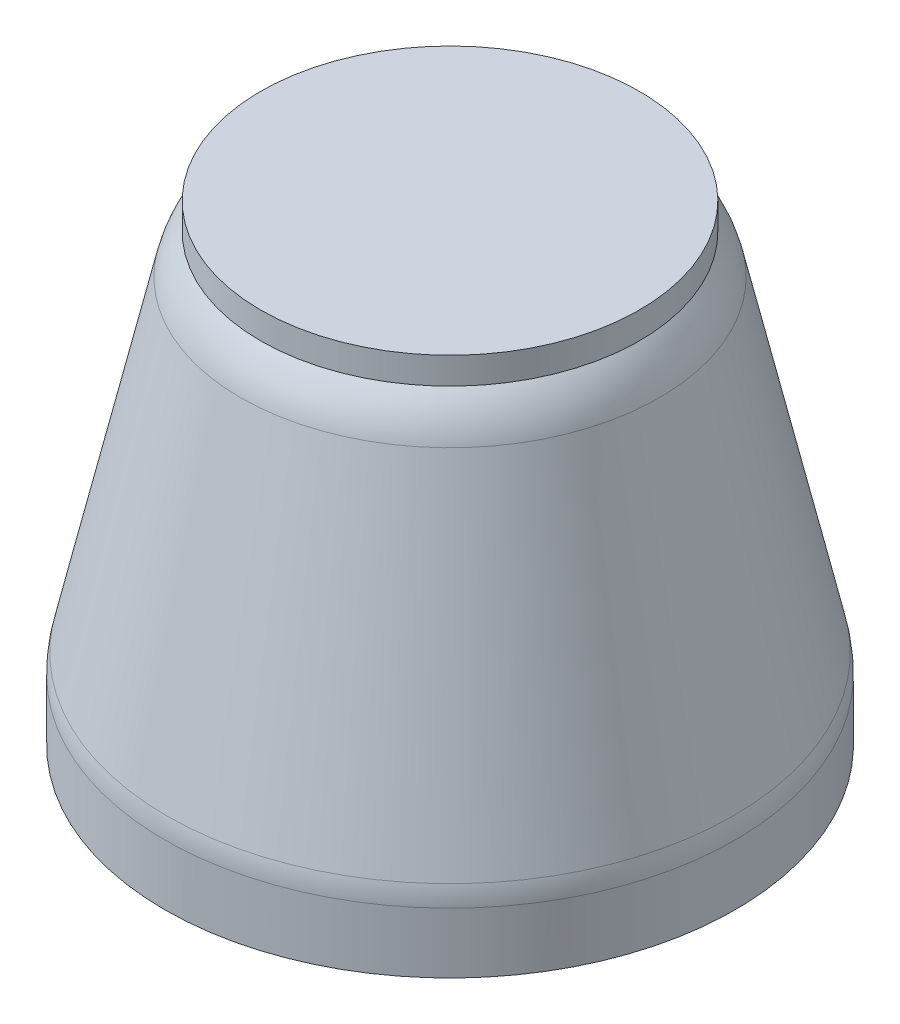
from build123d import *

# Parameters (mm, degrees)
SKETCH1_R           = 64
BOSS_EXTRUDE1_DEPTH = 15.8
SKETCH2_R           = 45
SKETCH3_R           = 42.5
BOSS_EXTRUDE2_DEPTH = 6
SKETCH4_R           = 50
CUT_EXTRUDE1_DEPTH  = 6
CUT_EXTRUDE1_DRAFT  = -20


with BuildPart() as part:
    # Sketch1 → Boss-Extrude1 (new body)
    with BuildSketch(Plane(origin=(0, 0, 0), x_dir=(1, 0, 0), z_dir=(0, 1, 0))):
        with Locations(Location((0, 0, 0), (0, 0, 270))):
            Circle(SKETCH1_R)
    extrude(amount=BOSS_EXTRUDE1_DEPTH)

    # Sketch2 → section 1 of loft1
    with BuildSketch(Plane(origin=(0, 99.8, 0), x_dir=(1, 0, 0), z_dir=(0, 1, 0)), mode=Mode.PRIVATE) as loft1_s1:
        Circle(SKETCH2_R)
    # loft up to a face of the part (loft1)
    loft([Face(Wire([part.edges().sort_by_distance((46.653992155, 15.8, -43.811014779))[0]])), loft1_s1.sketch])

    # Sketch3 → Boss-Extrude2 (add)
    with BuildSketch(Plane(origin=(0, 99.8, 0), x_dir=(1, 0, 0), z_dir=(0, 1, 0))):
        with Locations(Location((0, 0, 0), (0, 0, 270))):
            Circle(SKETCH3_R)
    extrude(amount=BOSS_EXTRUDE2_DEPTH)

    # Fillet1: read off the stored shape, not the designer's step
    # Fillet1 outline → Fillet1 (revolve, cut)
    with BuildSketch(Plane.XY):
        with BuildLine():
            Line((46.989688752, 91.003481309), (46.989688752, 99.8))
            Line((46.989688752, 99.8), (42.5, 99.8))
            ThreePointArc((42.5, 99.8), (45.296348434, 95.683224916), (46.989688752, 91.003481309))
        make_face()
        with BuildLine():
            Line((64, 17.978653915), (63.507209234, 17.978653915))
            ThreePointArc((63.507209234, 17.978653915), (63.876420511, 15.78619808), (64, 13.566308969))
            Line((64, 13.566308969), (64, 17.978653915))
        make_face()
    revolve(axis=Axis((0, 0, 0), (0, 1, 0)), mode=Mode.SUBTRACT)


with BuildPart() as cut_extrude1_tool:
    # Sketch4 → Cut-Extrude1 (with draft: the straight prism first)
    with BuildSketch(Plane.XZ):
        Circle(SKETCH4_R)
    extrude(amount=-CUT_EXTRUDE1_DEPTH)
    # Cut-Extrude1: the draft: its side faces are tilted about the plane it starts from
    cut_extrude1_sides = [cut_extrude1_tool.faces().sort_by_distance(p)[0] for p in [
        (-50, 3, 0),
    ]]
    draft(cut_extrude1_sides, Plane.XZ, CUT_EXTRUDE1_DRAFT)


with BuildPart() as part_1:
    add(part.part)

    # Cut-Extrude1: cut by cut_extrude1_tool
    add(cut_extrude1_tool.part, mode=Mode.SUBTRACT)


solid = part_1.part
